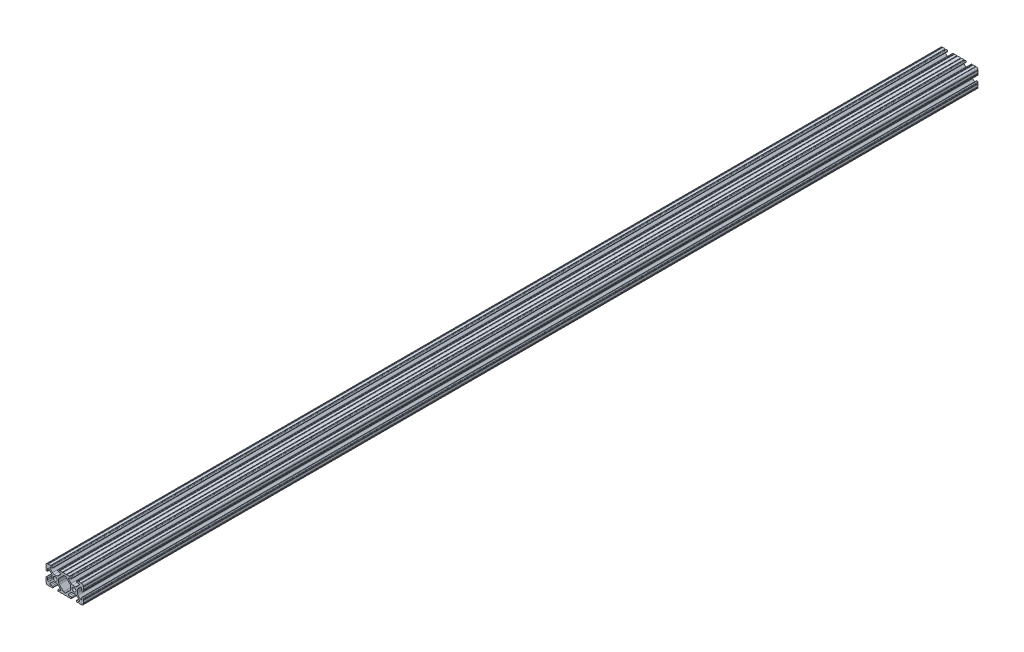
from build123d import *

# Parameters (mm, degrees)
SKETCH1_R           = 2.6035
BOSS_EXTRUDE1_DEPTH = 609.6


with BuildPart() as part:
    # Sketch1 → Boss-Extrude1 (new, symmetric)
    with BuildSketch(Plane.XY):
        with BuildLine():
            Line((18.01710265, 12.7), (16.98745015, 12.7))
            ThreePointArc((16.98745015, 12.7), (16.245730386, 12.392769614), (15.9385, 11.65104985))
            Line((15.9385, 11.65104985), (15.9385, 11.53922))
            ThreePointArc((15.9385, 11.53922), (16.245750844, 10.797450844), (16.98752, 10.4902))
            Line((16.98752, 10.4902), (19.116384363, 10.4902))
            ThreePointArc((19.116384363, 10.4902), (20.052502933, 9.869096983), (19.844087081, 8.765172272))
            Line((19.844087081, 8.765172272), (16.618993479, 5.455112286))
            ThreePointArc((16.618993479, 5.455112286), (15.578994274, 4.745442459), (14.344932584, 4.4958))
            Line((14.344932584, 4.4958), (11.083317835, 4.4958))
            ThreePointArc((11.083317835, 4.4958), (9.854330953, 4.743306833), (8.816955189, 5.447238587))
            Line((8.816955189, 5.447238587), (5.564154119, 8.762652677))
            ThreePointArc((5.564154119, 8.762652677), (5.352591412, 9.867473037), (6.289393385, 10.4902))
            Line((6.289393385, 10.4902), (8.41248, 10.4902))
            ThreePointArc((8.41248, 10.4902), (9.154249156, 10.797450844), (9.4615, 11.53922))
            Line((9.4615, 11.53922), (9.4615, 11.65104985))
            ThreePointArc((9.4615, 11.65104985), (9.154269614, 12.392769614), (8.41254985, 12.7))
            Line((8.41254985, 12.7), (7.38288465, 12.7))
            ThreePointArc((7.38288465, 12.7), (6.87488465, 12.192), (6.36688465, 12.7))
            Line((6.36688465, 12.7), (3.14958095, 12.7))
            ThreePointArc((3.14958095, 12.7), (2.64158095, 12.192), (2.13358095, 12.7))
            Line((2.13358095, 12.7), (-2.13358095, 12.7))
            ThreePointArc((-2.13358095, 12.7), (-2.64158095, 12.192), (-3.14958095, 12.7))
            Line((-3.14958095, 12.7), (-6.36689735, 12.7))
            ThreePointArc((-6.36689735, 12.7), (-6.87489735, 12.192), (-7.38289735, 12.7))
            Line((-7.38289735, 12.7), (-8.41254985, 12.7))
            ThreePointArc((-8.41254985, 12.7), (-9.154269614, 12.392769614), (-9.4615, 11.65104985))
            Line((-9.4615, 11.65104985), (-9.4615, 11.53922))
            ThreePointArc((-9.4615, 11.53922), (-9.154249156, 10.797450844), (-8.41248, 10.4902))
            Line((-8.41248, 10.4902), (-6.283641037, 10.4902))
            ThreePointArc((-6.283641037, 10.4902), (-5.297291557, 9.829633109), (-5.532576693, 8.666071843))
            Line((-5.532576693, 8.666071843), (-8.809985098, 5.416263103))
            ThreePointArc((-8.809985098, 5.416263103), (-9.836720513, 4.734920264), (-11.045536121, 4.4958))
            Line((-11.045536121, 4.4958), (-14.354463879, 4.4958))
            ThreePointArc((-14.354463879, 4.4958), (-15.563279487, 4.734920264), (-16.590014902, 5.416263103))
            Line((-16.590014902, 5.416263103), (-19.867423307, 8.666071843))
            ThreePointArc((-19.867423307, 8.666071843), (-20.102708443, 9.829633109), (-19.116358963, 10.4902))
            Line((-19.116358963, 10.4902), (-16.98752, 10.4902))
            ThreePointArc((-16.98752, 10.4902), (-16.245750844, 10.797450844), (-15.9385, 11.53922))
            Line((-15.9385, 11.53922), (-15.9385, 11.65104985))
            ThreePointArc((-15.9385, 11.65104985), (-16.245730386, 12.392769614), (-16.98745015, 12.7))
            Line((-16.98745015, 12.7), (-18.01711535, 12.7))
            ThreePointArc((-18.01711535, 12.7), (-18.52511535, 12.192), (-19.03311535, 12.7))
            Line((-19.03311535, 12.7), (-22.2504, 12.7))
            ThreePointArc((-22.2504, 12.7), (-22.758323491, 12.192000006), (-23.266399977, 12.699846982))
            ThreePointArc((-23.266399977, 12.699846982), (-24.782522516, 12.082522516), (-25.399846982, 10.566399977))
            ThreePointArc((-25.399846982, 10.566399977), (-24.892000006, 10.058323491), (-25.4, 9.5504))
            Line((-25.4, 9.5504), (-25.4, 6.3330836))
            ThreePointArc((-25.4, 6.3330836), (-24.892, 5.8250836), (-25.4, 5.3170836))
            Line((-25.4, 5.3170836), (-25.4, 4.237520184))
            ThreePointArc((-25.4, 4.237520184), (-25.107393763, 3.531106237), (-24.400979816, 3.2385))
            Line((-24.400979816, 3.2385), (-24.23922, 3.2385))
            ThreePointArc((-24.23922, 3.2385), (-23.497450844, 3.545750844), (-23.1902, 4.28752))
            Line((-23.1902, 4.28752), (-23.1902, 6.334741132))
            ThreePointArc((-23.1902, 6.334741132), (-22.556026952, 7.286023527), (-21.434002553, 7.066535717))
            Line((-21.434002553, 7.066535717), (-18.147950853, 3.808156468))
            ThreePointArc((-18.147950853, 3.808156468), (-17.452759693, 2.774838327), (-17.208501877, 1.553619571))
            Line((-17.208501877, 1.553619571), (-17.208501877, -1.695179196))
            ThreePointArc((-17.208501877, -1.695179196), (-17.450738657, -2.911536421), (-18.140486065, -3.942289578))
            Line((-18.140486065, -3.942289578), (-21.431579576, -7.227386226))
            ThreePointArc((-21.431579576, -7.227386226), (-22.55444896, -7.449940594), (-23.1902, -6.498002195))
            Line((-23.1902, -6.498002195), (-23.1902, -4.28752))
            ThreePointArc((-23.1902, -4.28752), (-23.497450844, -3.545750844), (-24.23922, -3.2385))
            Line((-24.23922, -3.2385), (-24.35098, -3.2385))
            ThreePointArc((-24.35098, -3.2385), (-25.092749156, -3.545750844), (-25.4, -4.28752))
            Line((-25.4, -4.28752), (-25.4, -5.3171344))
            ThreePointArc((-25.4, -5.3171344), (-24.892, -5.8251344), (-25.4, -6.3331344))
            Line((-25.4, -6.3331344), (-25.4, -9.5504))
            ThreePointArc((-25.4, -9.5504), (-24.892000006, -10.058323491), (-25.399846982, -10.566399977))
            ThreePointArc((-25.399846982, -10.566399977), (-24.782522516, -12.082522516), (-23.266399977, -12.699846982))
            ThreePointArc((-23.266399977, -12.699846982), (-22.758323491, -12.192000006), (-22.2504, -12.7))
            Line((-22.2504, -12.7), (-19.03308995, -12.7))
            ThreePointArc((-19.03308995, -12.7), (-18.52508995, -12.192), (-18.01708995, -12.7))
            Line((-18.01708995, -12.7), (-16.9874692, -12.7))
            ThreePointArc((-16.9874692, -12.7), (-16.245700044, -12.392749156), (-15.9384492, -11.65098))
            Line((-15.9384492, -11.65098), (-15.9384492, -11.53922))
            ThreePointArc((-15.9384492, -11.53922), (-16.245700044, -10.797450844), (-16.9874692, -10.4902))
            Line((-16.9874692, -10.4902), (-19.116358963, -10.4902))
            ThreePointArc((-19.116358963, -10.4902), (-20.055197748, -9.862578342), (-19.834124023, -8.755124678))
            Line((-19.834124023, -8.755124678), (-16.49660751, -5.423689618))
            ThreePointArc((-16.49660751, -5.423689618), (-15.467274017, -4.736928798), (-14.253591699, -4.4958))
            Line((-14.253591699, -4.4958), (-11.146408301, -4.4958))
            ThreePointArc((-11.146408301, -4.4958), (-9.932725983, -4.736928798), (-8.90339249, -5.423689618))
            Line((-8.90339249, -5.423689618), (-5.565875977, -8.755124678))
            ThreePointArc((-5.565875977, -8.755124678), (-5.344802252, -9.862578342), (-6.283641037, -10.4902))
            Line((-6.283641037, -10.4902), (-8.4125308, -10.4902))
            ThreePointArc((-8.4125308, -10.4902), (-9.154299956, -10.797450844), (-9.4615508, -11.53922))
            Line((-9.4615508, -11.53922), (-9.4615508, -11.65098))
            ThreePointArc((-9.4615508, -11.65098), (-9.154299956, -12.392749156), (-8.4125308, -12.7))
            Line((-8.4125308, -12.7), (-7.38287195, -12.7))
            ThreePointArc((-7.38287195, -12.7), (-6.87487195, -12.192), (-6.36687195, -12.7))
            Line((-6.36687195, -12.7), (-3.14960635, -12.7))
            ThreePointArc((-3.14960635, -12.7), (-2.64160635, -12.192), (-2.13360635, -12.7))
            Line((-2.13360635, -12.7), (2.13360635, -12.7))
            ThreePointArc((2.13360635, -12.7), (2.64159365, -12.1920127), (3.14958095, -12.7))
            Line((3.14958095, -12.7), (6.36691005, -12.7))
            ThreePointArc((6.36691005, -12.7), (6.87491005, -12.192), (7.38291005, -12.7))
            Line((7.38291005, -12.7), (8.4125308, -12.7))
            ThreePointArc((8.4125308, -12.7), (9.154299956, -12.392749156), (9.4615508, -11.65098))
            Line((9.4615508, -11.65098), (9.4615508, -11.53922))
            ThreePointArc((9.4615508, -11.53922), (9.154299956, -10.797450844), (8.4125308, -10.4902))
            Line((8.4125308, -10.4902), (6.289393385, -10.4902))
            ThreePointArc((6.289393385, -10.4902), (5.231590322, -9.783049717), (5.480677245, -8.535265862))
            Line((5.480677245, -8.535265862), (8.597933595, -5.423689618))
            ThreePointArc((8.597933595, -5.423689618), (9.627267088, -4.736928798), (10.840949406, -4.4958))
            Line((10.840949406, -4.4958), (14.102564155, -4.4958))
            ThreePointArc((14.102564155, -4.4958), (15.215927525, -4.697410182), (16.187895372, -5.276636531))
            Line((16.187895372, -5.276636531), (19.868247549, -8.482246082))
            ThreePointArc((19.868247549, -8.482246082), (20.188435806, -9.746879864), (19.116384363, -10.4902))
            Line((19.116384363, -10.4902), (16.9874692, -10.4902))
            ThreePointArc((16.9874692, -10.4902), (16.245700044, -10.797450844), (15.9384492, -11.53922))
            Line((15.9384492, -11.53922), (15.9384492, -11.65098))
            ThreePointArc((15.9384492, -11.65098), (16.245700044, -12.392749156), (16.9874692, -12.7))
            Line((16.9874692, -12.7), (18.01710265, -12.7))
            ThreePointArc((18.01710265, -12.7), (18.52510265, -12.192), (19.03310265, -12.7))
            Line((19.03310265, -12.7), (22.2504, -12.7))
            ThreePointArc((22.2504, -12.7), (22.758323491, -12.192000006), (23.266399977, -12.699846982))
            ThreePointArc((23.266399977, -12.699846982), (24.782522516, -12.082522516), (25.399846982, -10.566399977))
            ThreePointArc((25.399846982, -10.566399977), (24.892000006, -10.058323492), (25.4, -9.550400001))
            Line((25.4, -9.550400001), (25.4, -6.333083592))
            ThreePointArc((25.4, -6.333083592), (24.892000001, -5.825083593), (25.4, -5.317083593))
            Line((25.4, -5.317083593), (25.4, -4.237520184))
            ThreePointArc((25.4, -4.237520184), (25.107393763, -3.531106237), (24.400979816, -3.2385))
            Line((24.400979816, -3.2385), (24.189220184, -3.2385))
            ThreePointArc((24.189220184, -3.2385), (23.482806237, -3.531106237), (23.1902, -4.237520184))
            Line((23.1902, -4.237520184), (23.1902, -6.155876159))
            ThreePointArc((23.1902, -6.155876159), (22.62232736, -7.038258539), (21.583974541, -6.886926384))
            Line((21.583974541, -6.886926384), (18.29817066, -4.024970844))
            ThreePointArc((18.29817066, -4.024970844), (17.493730985, -2.946044689), (17.208501877, -1.630807374))
            Line((17.208501877, -1.630807374), (17.208501877, 1.630807374))
            ThreePointArc((17.208501877, 1.630807374), (17.442348332, 2.82673414), (18.109440981, 3.846495088))
            Line((18.109440981, 3.846495088), (21.526346532, 7.353420386))
            ThreePointArc((21.526346532, 7.353420386), (22.585896263, 7.574939077), (23.1902, 6.676867167))
            Line((23.1902, 6.676867167), (23.1902, 4.237520184))
            ThreePointArc((23.1902, 4.237520184), (23.482806237, 3.531106237), (24.189220184, 3.2385))
            Line((24.189220184, 3.2385), (24.400979816, 3.2385))
            ThreePointArc((24.400979816, 3.2385), (25.107393763, 3.531106237), (25.4, 4.237520184))
            Line((25.4, 4.237520184), (25.4, 5.3170836))
            ThreePointArc((25.4, 5.3170836), (24.891949193, 5.825134407), (25.4, 6.333185215))
            Line((25.4, 6.333185215), (25.4, 9.550400015))
            ThreePointArc((25.4, 9.550400015), (24.892000013, 10.058323498), (25.399846982, 10.566399977))
            ThreePointArc((25.399846982, 10.566399977), (24.782522516, 12.082522516), (23.266399977, 12.699846982))
            ThreePointArc((23.266399977, 12.699846982), (22.758323491, 12.192000006), (22.2504, 12.7))
            Line((22.2504, 12.7), (19.03310265, 12.7))
            ThreePointArc((19.03310265, 12.7), (18.52510265, 12.192), (18.01710265, 12.7))
        make_face()
        with Locations((-12.7, 0)):
            Circle(SKETCH1_R, mode=Mode.SUBTRACT)
        with Locations((12.7, 0)):
            Circle(SKETCH1_R, mode=Mode.SUBTRACT)
        with BuildLine():
            Line((-7.259513935, -3.869413038), (-1.545748891, -9.572766749))
            ThreePointArc((-1.545748891, -9.572766749), (-1.035199478, -9.913400116), (-0.433213048, -10.033))
            Line((-0.433213048, -10.033), (0.433213048, -10.033))
            ThreePointArc((0.433213048, -10.033), (1.035199478, -9.913400116), (1.545748891, -9.572766749))
            Line((1.545748891, -9.572766749), (7.259513935, -3.869413038))
            ThreePointArc((7.259513935, -3.869413038), (7.949261343, -2.838659881), (8.191498123, -1.622302656))
            Line((8.191498123, -1.622302656), (8.191498123, 1.622302656))
            ThreePointArc((8.191498123, 1.622302656), (7.955573352, 2.823327967), (7.282860769, 3.845864069))
            Line((7.282860769, 3.845864069), (1.675572808, 9.561086461))
            ThreePointArc((1.675572808, 9.561086461), (1.161034429, 9.910236611), (0.551456936, 10.033))
            Line((0.551456936, 10.033), (-0.395199982, 10.033))
            ThreePointArc((-0.395199982, 10.033), (-0.994772524, 9.914396349), (-1.50403329, 9.576450301))
            Line((-1.50403329, 9.576450301), (-7.252049147, 3.876839553))
            ThreePointArc((-7.252049147, 3.876839553), (-7.947240307, 2.843521412), (-8.191498123, 1.622302656))
            Line((-8.191498123, 1.622302656), (-8.191498123, -1.622302656))
            ThreePointArc((-8.191498123, -1.622302656), (-7.949261343, -2.838659881), (-7.259513935, -3.869413038))
        make_face(mode=Mode.SUBTRACT)
    extrude(amount=BOSS_EXTRUDE1_DEPTH, both=True)


solid = part.part
